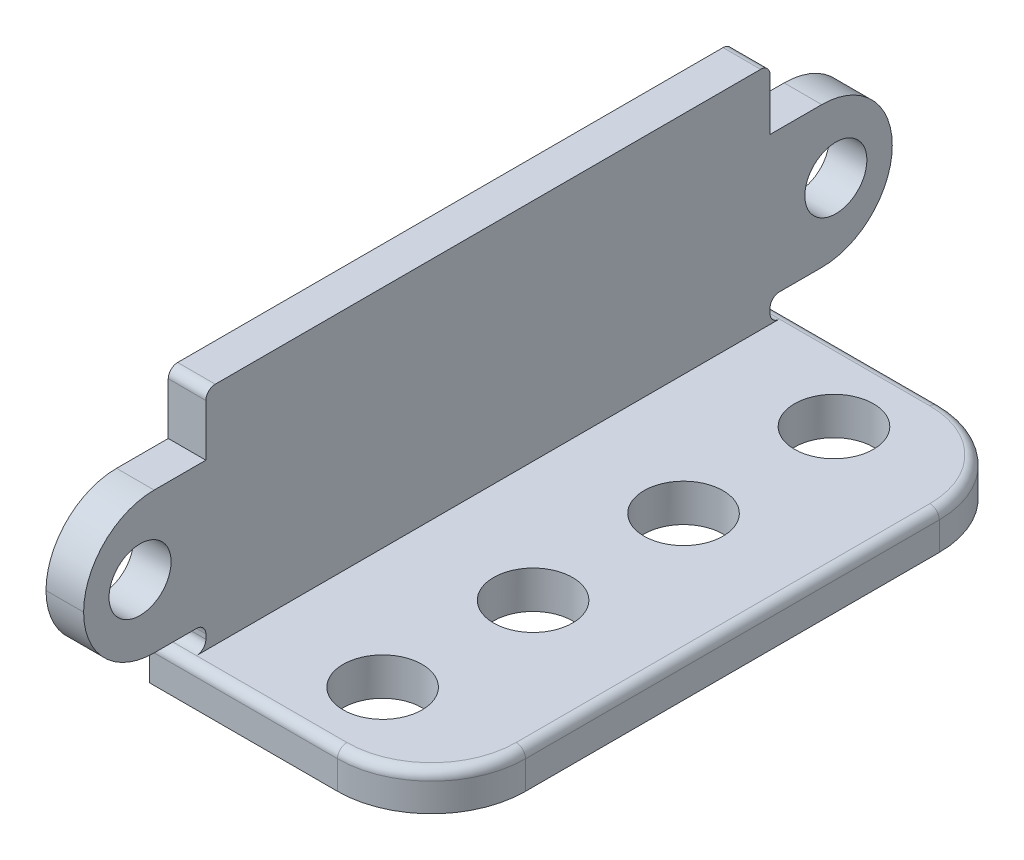
from build123d import *

# Parameters (mm, degrees)
SKETCH_1_W          = 43
SKETCH_1_H          = 7.5
EXTRUDE_1_DEPTH     = 2
SKETCH_2_R          = 1.65
CUT_EXTRUDE_2_DEPTH = 11.5
FILLET_1_R          = 3.75
SKETCH_3_W          = 30
SKETCH_3_H          = 14
EXTRUDE_3_DEPTH     = 2
SKETCH_4_W          = 15
SKETCH_4_H          = 32
EXTRUDE_4_DEPTH     = 2
SKETCH_5_R          = 2.1
CUT_EXTRUDE_3_DEPTH = 13
FILLET_3_R          = 5
FILLET_5_R          = 0.5
FILLET_6_R          = 0.5
FILLET_7_R          = 0.5


with BuildPart() as part:
    # 草圖1 → 填料-伸長1 (new body)
    with BuildSketch(Plane(origin=(0, 0, 0), x_dir=(0, 0, -1), z_dir=(1, 0, 0))):
        Rectangle(SKETCH_1_W, SKETCH_1_H)
    extrude(amount=EXTRUDE_1_DEPTH)

    # 草圖2 → 除料-伸長2 (cut)
    with BuildSketch(Plane(origin=(2, 0, 0), x_dir=(0, 0, -1), z_dir=(1, 0, 0))):
        with Locations((-18.5, 0)):
            Circle(SKETCH_2_R)
        with Locations((18.5, 0)):
            Circle(SKETCH_2_R)
    extrude(amount=-CUT_EXTRUDE_2_DEPTH, mode=Mode.SUBTRACT)

    # 圓角1
    fillet_1_edges = [part.edges().sort_by_distance(p)[0] for p in [
        (1, -3.75, -21.5),
        (1, 3.75, -21.5),
        (1, -3.75, 21.5),
        (1, 3.75, 21.5),
    ]]
    fillet(fillet_1_edges, radius=FILLET_1_R - 0.0001)  # a hair under: the kernel refuses the full size

    # 草圖3 → 填料-伸長3 (add)
    with BuildSketch(Plane.ZY):
        Rectangle(SKETCH_3_W, SKETCH_3_H)
    extrude(amount=-EXTRUDE_3_DEPTH)

    # 草圖4 → 填料-伸長4 (add)
    with BuildSketch(Plane(origin=(0, -7, 0), x_dir=(1, 0, 0), z_dir=(0, 1, 0))):
        with Locations((7.5, 0)):
            Rectangle(SKETCH_4_W, SKETCH_4_H)
    extrude(amount=EXTRUDE_4_DEPTH)

    # 草圖5 → 除料-伸長3 (cut)
    with BuildSketch(Plane(origin=(0, -5, 0), x_dir=(-1, 0, 0), z_dir=(0, 1, 0))):
        with Locations(Location((-8.4, 12, 0), (0, 0, 90))):
            Circle(SKETCH_5_R)
        with Locations(Location((-8.4, 4, 0), (0, 0, 90))):
            Circle(SKETCH_5_R)
        with Locations(Location((-8.4, -4, 0), (0, 0, 90))):
            Circle(SKETCH_5_R)
        with Locations(Location((-8.4, -12, 0), (0, 0, 90))):
            Circle(SKETCH_5_R)
    extrude(amount=-CUT_EXTRUDE_3_DEPTH, mode=Mode.SUBTRACT)

    # 圓角3
    fillet_3_edges = [part.edges().sort_by_distance(p)[0] for p in [
        (15, -6, 16),
        (15, -6, -16),
    ]]
    fillet(fillet_3_edges, radius=FILLET_3_R)

    # 圓角5
    fillet_5_edges = [part.edges().sort_by_distance(p)[0] for p in [
        (1, -3.75, -15),
        (1, -3.75, 15),
        (1, -5, -15),
        (1, -5, 15),
    ]]
    fillet(fillet_5_edges, radius=FILLET_5_R)

    # 圓角6
    fillet_6_edges = [part.edges().sort_by_distance(p)[0] for p in [
        (5, -5, 16),
        (13.535533906, -5, 14.535533906),
        (15, -5, 0),
        (13.535533906, -5, -14.535533906),
        (5, -5, -16),
    ]]
    fillet(fillet_6_edges, radius=FILLET_6_R - 0.0001)  # a hair under: the kernel refuses the full size

    # 圓角7
    fillet_7_edges = [part.edges().sort_by_distance(p)[0] for p in [
        (1, 7, 15),
        (1, 7, -15),
    ]]
    fillet(fillet_7_edges, radius=FILLET_7_R)


solid = part.part
